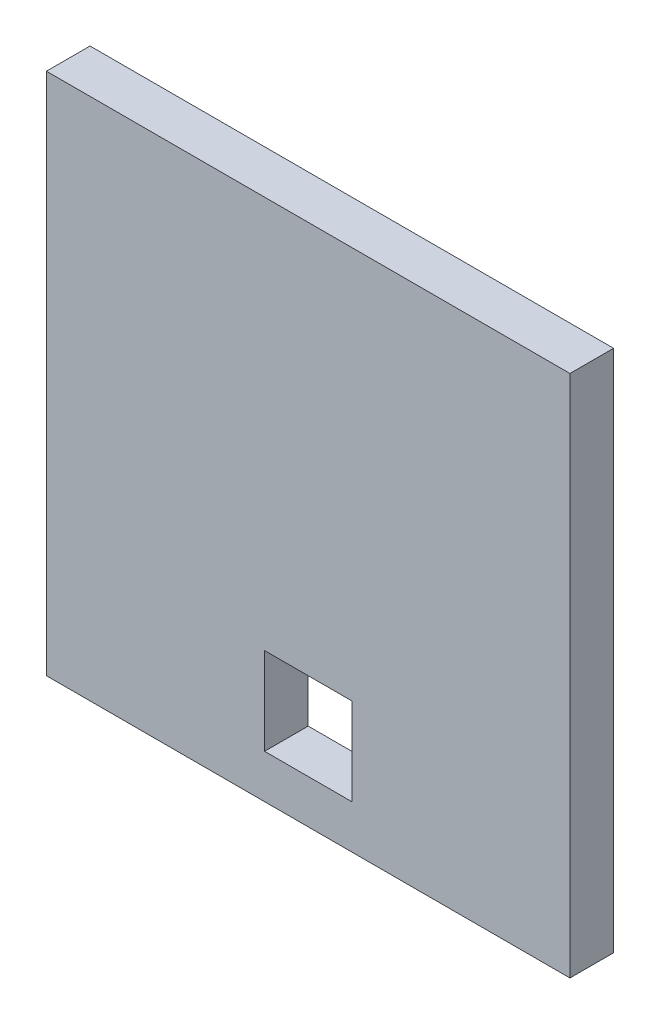
from build123d import *

# Parameters (mm, degrees)
SKETCH2_W           = 38.1
SKETCH2_H           = 38.1
BOSS_EXTRUDE1_DEPTH = 3.175
SKETCH8_W           = 6.35
SKETCH8_H           = 6.35
CUT_EXTRUDE2_DEPTH  = 54.975


with BuildPart() as part:
    # Sketch2 → Boss-Extrude1 (new body)
    with BuildSketch(Plane.XY):
        with Locations((19.05, 19.05)):
            Rectangle(SKETCH2_W, SKETCH2_H)
    extrude(amount=BOSS_EXTRUDE1_DEPTH)

    # Sketch8 → Cut-Extrude2 (cut, through all)
    with BuildSketch(Plane.XY.offset(3.175)):
        with Locations((19.05, 6.35)):
            Rectangle(SKETCH8_W, SKETCH8_H)
    extrude(amount=-CUT_EXTRUDE2_DEPTH, mode=Mode.SUBTRACT)


solid = part.part
